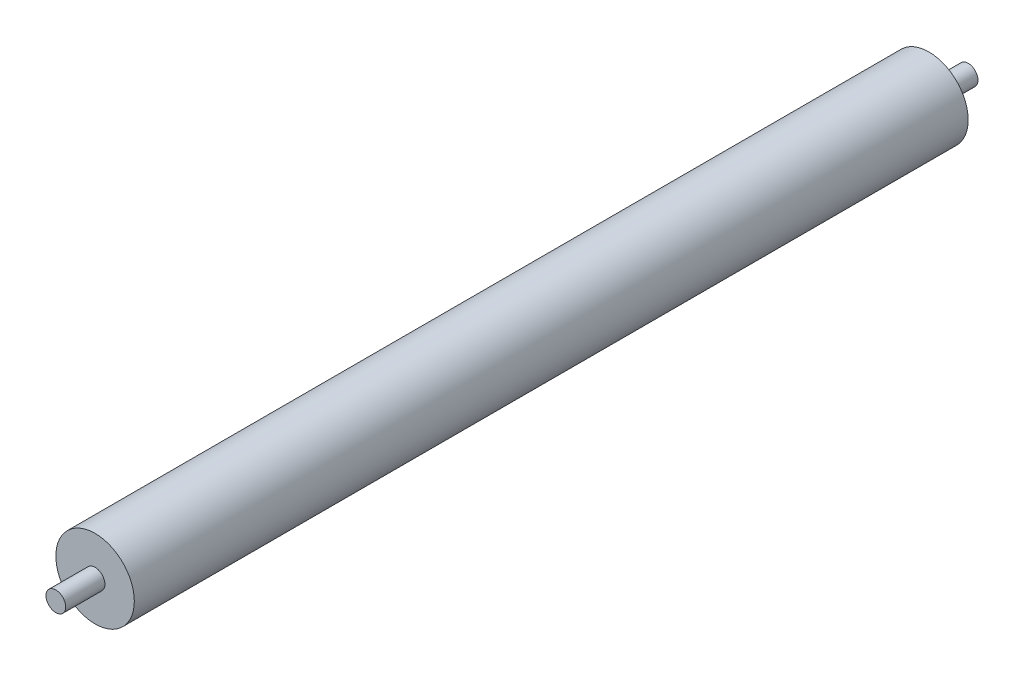
from build123d import *

# Parameters (mm, degrees)
SKETCH1_R           = 25.4
BOSS_EXTRUDE1_DEPTH = 590.55
SKETCH2_OUTSIDE_W   = 171.78
SKETCH2_OUTSIDE_H   = 171.78
SKETCH2_OUTSIDE_R   = 6.361935525
CUT_EXTRUDE1_DEPTH  = 25.4
SKETCH5_OUTSIDE_W   = 171.78
SKETCH5_OUTSIDE_H   = 171.78
SKETCH5_OUTSIDE_R   = 6.377907631
CUT_EXTRUDE4_DEPTH  = 25.4
SHELL3_START        = 33.02
SHELL3_OUTLINE_R    = 17.78
SHELL3_DEPTH        = 524.51


# Read off the part's stored shape, not the designer's step: Shell3
with BuildPart() as part:
    # Sketch1 → Boss-Extrude1 (new body)
    with BuildSketch(Plane.XY):
        Circle(SKETCH1_R)
    extrude(amount=BOSS_EXTRUDE1_DEPTH)

    # Sketch2 outside → Cut-Extrude1 (cut)
    with BuildSketch(Plane.XY):
        Rectangle(SKETCH2_OUTSIDE_W, SKETCH2_OUTSIDE_H)
        Circle(SKETCH2_OUTSIDE_R, mode=Mode.SUBTRACT)
    extrude(amount=CUT_EXTRUDE1_DEPTH, mode=Mode.SUBTRACT)

    # Sketch5 outside → Cut-Extrude4 (cut)
    with BuildSketch(Plane.XY.offset(590.55)):
        Rectangle(SKETCH5_OUTSIDE_W, SKETCH5_OUTSIDE_H)
        Circle(SKETCH5_OUTSIDE_R, mode=Mode.SUBTRACT)
    extrude(amount=-CUT_EXTRUDE4_DEPTH, mode=Mode.SUBTRACT)

    # Shell3 outline → Shell3 (cut)
    with BuildSketch(Plane.XY.offset(SHELL3_START)):
        Circle(SHELL3_OUTLINE_R)
    extrude(amount=SHELL3_DEPTH, mode=Mode.SUBTRACT)


solid = part.part
